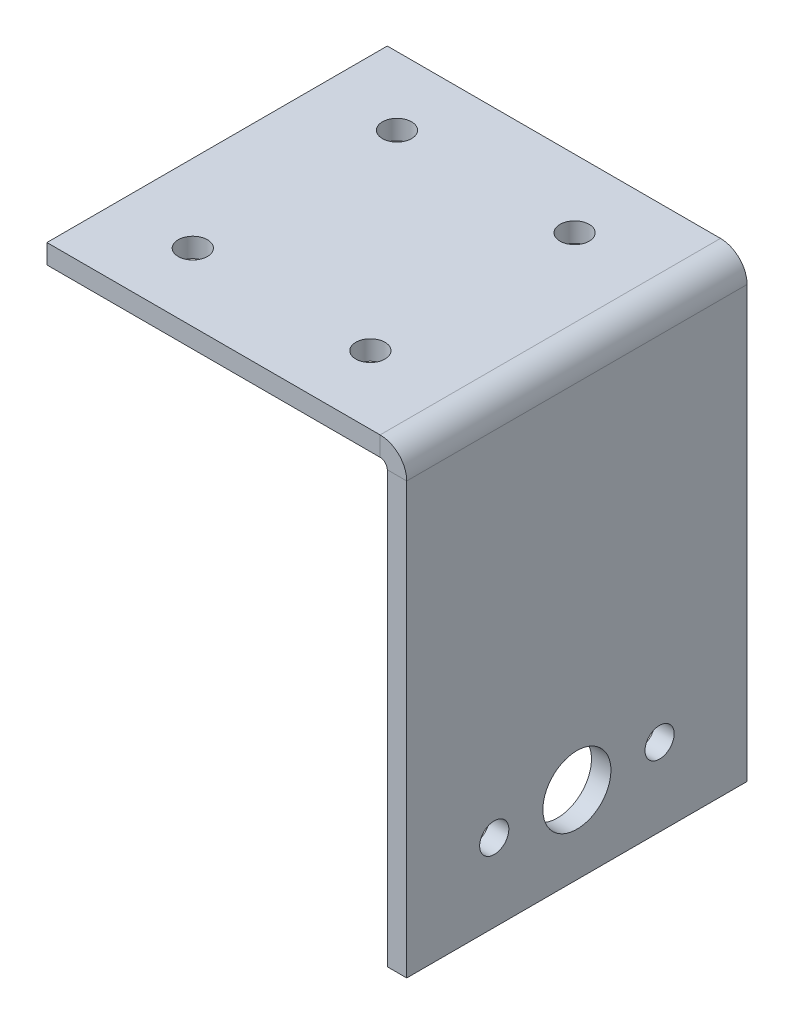
from build123d import *

# Parameters (mm, degrees)
T_LE_DE_BASE_PLI_E1_DEPTH = 35
ESQUISSE14_R              = 1.5
ENL_V_MAT_EXTRU_1_DEPTH   = 2
ESQUISSE15_R              = 3.5
ESQUISSE15_R_2            = 1.5
ENL_V_MAT_EXTRU_2_DEPTH   = 2


# Sheet-metal steps are written as plain solids
with BuildPart() as part:
    # Esquisse8 → Tôle de base pliée1 (new body)
    with BuildSketch(Plane.XY):
        with BuildLine():
            Line((-35, 0), (-0.7366, 0))
            ThreePointArc((-0.7366, 0), (-0.215745145, -0.215745145), (0, -0.7366))
            Line((0, -0.7366), (0, -45))
            Line((0, -45), (2, -45))
            Line((2, -45), (2, -0.7366))
            ThreePointArc((2, -0.7366), (1.198468417, 1.198468417), (-0.7366, 2))
            Line((-0.7366, 2), (-35, 2))
            Line((-35, 2), (-35, 0))
        make_face()
    extrude(amount=T_LE_DE_BASE_PLI_E1_DEPTH)

    # Esquisse14 → Enlèv. mat.-Extru.1 (cut)
    with BuildSketch(Plane(origin=(0, 2, 0), x_dir=(1, 0, 0), z_dir=(0, 1, 0))):
        with Locations(Location((-27, -7, 0), (0, 0, 270))):
            Circle(ESQUISSE14_R)
        with Locations(Location((-8.7366, -7, 0), (0, 0, 270))):
            Circle(ESQUISSE14_R)
        with Locations(Location((-8.7366, -28, 0), (0, 0, 270))):
            Circle(ESQUISSE14_R)
        with Locations(Location((-27, -28, 0), (0, 0, 270))):
            Circle(ESQUISSE14_R)
    extrude(amount=-ENL_V_MAT_EXTRU_1_DEPTH, mode=Mode.SUBTRACT)

    # Esquisse15 → Enlèv. mat.-Extru.2 (cut)
    with BuildSketch(Plane(origin=(2, 0, 0), x_dir=(0, 0, -1), z_dir=(1, 0, 0))):
        with Locations(Location((-17.5, -37, 0), (0, 0, 90))):
            Circle(ESQUISSE15_R)
        with Locations(Location((-9, -37, 0), (0, 0, 90))):
            Circle(ESQUISSE15_R_2)
        with Locations(Location((-26, -37, 0), (0, 0, 90))):
            Circle(ESQUISSE15_R_2)
    extrude(amount=-ENL_V_MAT_EXTRU_2_DEPTH, mode=Mode.SUBTRACT)


solid = part.part
